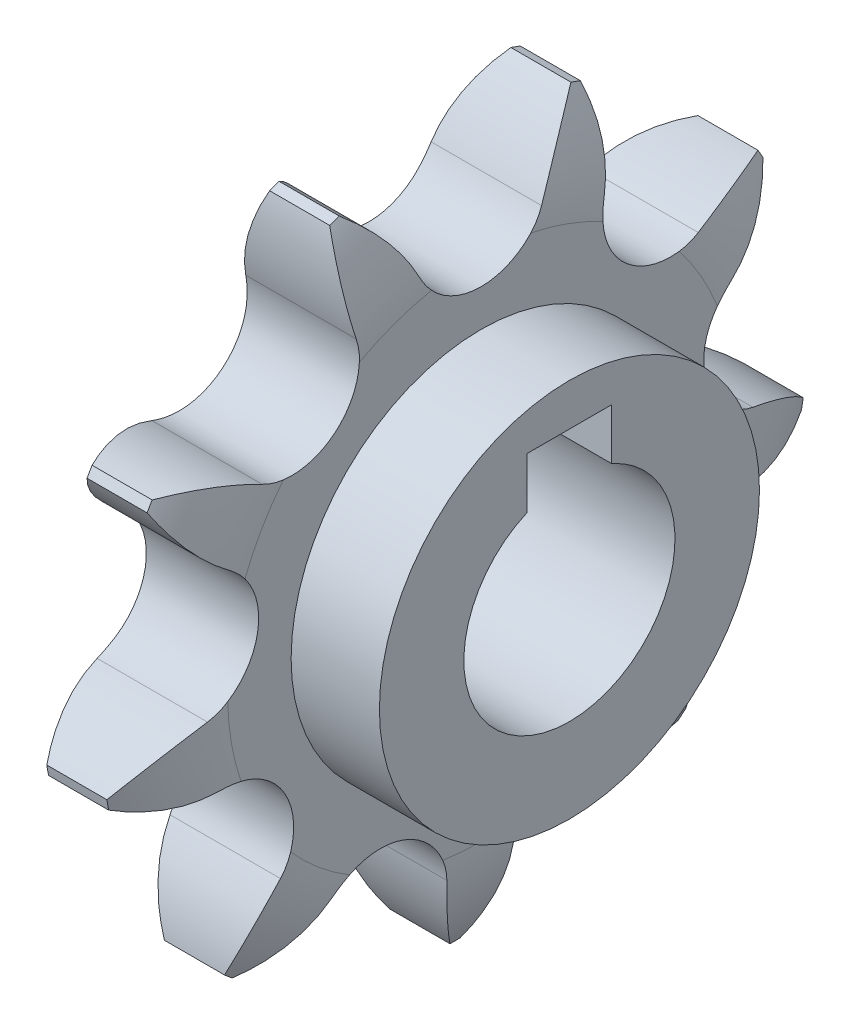
from build123d import *

# Parameters (mm, degrees)
TOOTHCUT_DEPTH      = 25.212835916
TEETHCUTS_COUNT     = 9
TEETHCUTS_ANGLE     = 320
BORSKE_R            = 5
BORE_DEPTH          = 50.0005
SKETCH1_R           = 9
SKETCH1_R_2         = 3
BOSS_EXTRUDE1_DEPTH = 16.6804
CUT_EXTRUDE1_START  = 24
SKETCH2_R           = 5
CUT_EXTRUDE1_DEPTH  = 24
CUT_EXTRUDE2_START  = -22
CUT_EXTRUDE2_DEPTH  = 22
SKETCH4_R           = 12.175934289
CUT_EXTRUDE3_DEPTH  = 12.5


# Read off the part's stored shape, not the designer's step: Cut-Extrude2
with BuildPart() as part:
    # BasProSke → Base-Revolve (revolve)
    with BuildSketch(Plane(origin=(0, 0, 0), x_dir=(1, 0, 0), z_dir=(0, 1, 0)), mode=Mode.PRIVATE) as base_revolve_sk:
        with BuildLine():
            Line((0, 0), (0, 12.006866982))
            ThreePointArc((0, 12.006866982), (0.314698702, 14.435029868), (1.238, 16.702743471))
            Line((1.238, 16.702743471), (4.0816, 16.702743471))
            ThreePointArc((4.0816, 16.702743471), (5.004901298, 14.435029868), (5.3196, 12.006866982))
            Line((5.3196, 12.006866982), (5.3196, 0))
            Line((5.3196, 0), (0, 0))
        make_face()
    revolve(base_revolve_sk.sketch.rotate(Axis((-10, 0, 0), (1, 0, 0)), 180), axis=Axis((-10, 0, 0), (1, 0, 0)))

    # TooCutSke → ToothCut (cut, through all)
    with BuildSketch(Plane(origin=(0, 0, 0), x_dir=(0, 0, -1), z_dir=(1, 0, 0))):
        with BuildLine():
            ThreePointArc((2.906302496, 12.60113736), (4.198990076, 14.583034398), (5.994051414, 16.124693193))
            ThreePointArc((5.994051414, 16.124693193), (0, 17.202743471), (-5.994051414, 16.124693193))
            ThreePointArc((-5.994051414, 16.124693193), (-4.198990076, 14.583034398), (-2.906302496, 12.60113736))
            ThreePointArc((-2.906302496, 12.60113736), (0, 10.749618471), (2.906302496, 12.60113736))
        make_face()
    toothcut = extrude(amount=TOOTHCUT_DEPTH, mode=Mode.SUBTRACT)

    # TeethCuts: ToothCut ×9 about axis
    teethcuts_axis = Axis((-10, 0, 0), (1, 0, 0))
    for i in range(1, TEETHCUTS_COUNT):
        add(toothcut.rotate(teethcuts_axis, i * TEETHCUTS_ANGLE / (TEETHCUTS_COUNT - 1)), mode=Mode.SUBTRACT)

    # BorSke → Bore (cut, symmetric)
    with BuildSketch(Plane(origin=(0, 0, 0), x_dir=(0, 0, -1), z_dir=(1, 0, 0))):
        with Locations(Location((0, 0, 0), (0, 0, 180))):
            Circle(BORSKE_R)
    extrude(amount=BORE_DEPTH, both=True, mode=Mode.SUBTRACT)

    # Sketch1 → Boss-Extrude1 (add)
    with BuildSketch(Plane(origin=(5.3196, 0, 0), x_dir=(0, 0, -1), z_dir=(1, 0, 0))):
        with Locations(Location((0, 0, 0), (0, 0, 180))):
            Circle(SKETCH1_R)
        Circle(SKETCH1_R_2, mode=Mode.SUBTRACT)
    extrude(amount=BOSS_EXTRUDE1_DEPTH)

    # Sketch2 → Cut-Extrude1 (cut)
    with BuildSketch(Plane(origin=(0, 0, 0), x_dir=(0, 0, -1), z_dir=(1, 0, 0)).offset(CUT_EXTRUDE1_START)):
        Circle(SKETCH2_R)
    extrude(amount=-CUT_EXTRUDE1_DEPTH, mode=Mode.SUBTRACT)

    # Cut-Extrude2 outline → Cut-Extrude2 (cut)
    with BuildSketch(Plane.ZY.offset(CUT_EXTRUDE2_START)):
        with BuildLine():
            Line((2, 4.582575695), (2, 7))
            Line((2, 7), (-2, 7))
            Line((-2, 7), (-2, 4.582575695))
            ThreePointArc((-2, 4.582575695), (0, 5), (2, 4.582575695))
        make_face()
    extrude(amount=CUT_EXTRUDE2_DEPTH, mode=Mode.SUBTRACT)

    # Sketch4 → Cut-Extrude3 (cut)
    with BuildSketch(Plane(origin=(22, 0, 0), x_dir=(0, 0, -1), z_dir=(1, 0, 0))):
        Circle(SKETCH4_R)
    extrude(amount=-CUT_EXTRUDE3_DEPTH, mode=Mode.SUBTRACT)


solid = part.part
